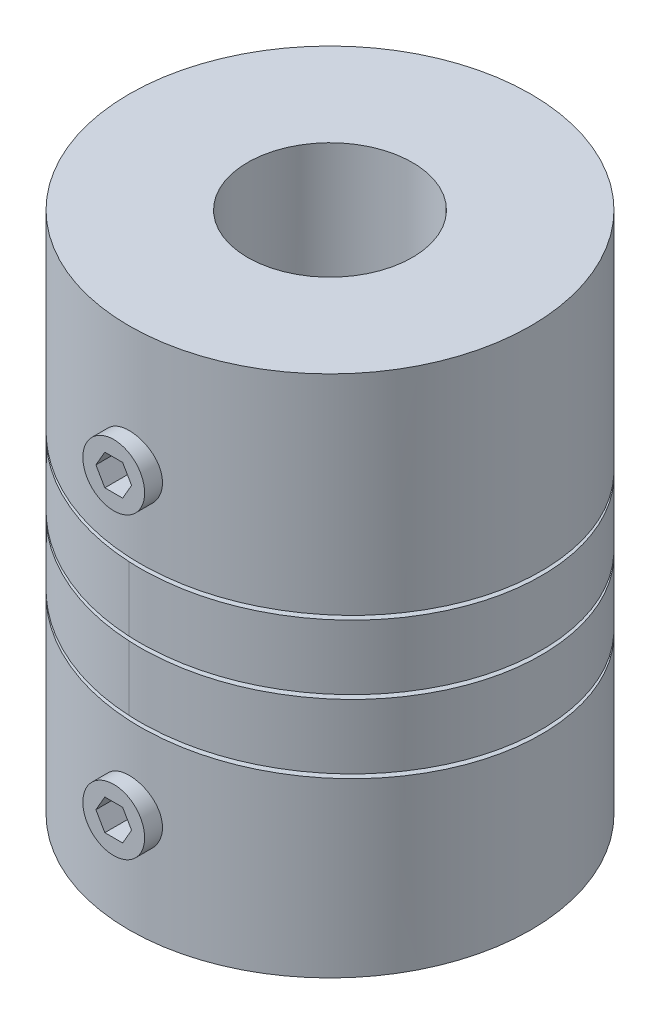
from build123d import *

# Parameters (mm, degrees)
SKETCH1_R             = 9.75
EXTRUDE1_DEPTH        = 25.4
SKETCH2_R             = 4
EXTRUDE2_DEPTH        = 12.7
SKETCH3_R             = 2
EXTRUDE3_DEPTH        = 12.7
SKETCH4_R             = 1.5
EXTRUDE5_DEPTH        = 9.75
CUT_SWEEP8_PITCH      = 3.333333333
EXTRUDE6_DEPTH        = 3
EXTRUDE6_DEPTH_BACK   = 3
SKETCH11_R            = 1.5
EXTRUDE6_2_DEPTH      = 3
EXTRUDE6_2_DEPTH_BACK = 3
EXTRUDE7_DEPTH        = 3


with BuildPart() as part:
    # Sketch1 → Extrude1 (new body)
    with BuildSketch(Plane(origin=(0, 0, 0), x_dir=(1, 0, 0), z_dir=(0, 1, 0))):
        with Locations(Location((0, 0, 0), (0, 0, 270))):
            Circle(SKETCH1_R)
    extrude(amount=EXTRUDE1_DEPTH)

    # Sketch2 → Extrude2 (cut)
    with BuildSketch(Plane(origin=(0, 25.4, 0), x_dir=(-1, 0, 0), z_dir=(0, 1, 0))):
        with Locations(Location((0, 0, 0), (0, 0, 90))):
            Circle(SKETCH2_R)
    extrude(amount=-EXTRUDE2_DEPTH, mode=Mode.SUBTRACT)

    # Sketch3 → Extrude3 (cut)
    with BuildSketch(Plane.XZ):
        with Locations(Location((0, 0, 0), (0, 0, 270))):
            Circle(SKETCH3_R)
    extrude(amount=-EXTRUDE3_DEPTH, mode=Mode.SUBTRACT)

    # Sketch4 → Extrude5 (cut)
    with BuildSketch(Plane.XY.offset(9.75)):
        with Locations(Location((0, 19.5, 0), (0, 0, 270))):
            Circle(SKETCH4_R)
        with Locations((0, 5)):
            Circle(SKETCH4_R)
    extrude(amount=-EXTRUDE5_DEPTH, mode=Mode.SUBTRACT)

    # Cut-Sweep8: the profile of Sketch10 screwed along a left-hand helix of 3 turns, 12 arcs to a turn; built about Z, then put on its axis
    cut_sweep8_z = Axis((0, 0, 0), (0, 0, 1))
    cut_sweep8_corners = [(10, 0, -0.15), (1, 0, -0.15), (1, 0, -0.35), (10, 0, -0.35)]
    with BuildLine(mode=Mode.PRIVATE) as cut_sweep8_profile:
        Line(cut_sweep8_corners[0], cut_sweep8_corners[1])
        Line(cut_sweep8_corners[1], cut_sweep8_corners[2])
        Line(cut_sweep8_corners[2], cut_sweep8_corners[3])
        Line(cut_sweep8_corners[3], cut_sweep8_corners[0])
    cut_sweep8_cap = Face(cut_sweep8_profile.wire())
    cut_sweep8_turn_angles = [0, -15, -30, -45, -60, -75, -90, -105, -120, -135, -150, -165, -180, -195, -210, -225, -240, -255, -270, -285, -300, -315, -330, -345, -360]
    cut_sweep8_turn_weights = [1, 0.9659258262890683, 1, 0.9659258262890683, 1, 0.9659258262890683, 1, 0.9659258262890683, 1, 0.9659258262890683, 1, 0.9659258262890683, 1, 0.9659258262890683, 1, 0.9659258262890683, 1, 0.9659258262890683, 1, 0.9659258262890683, 1, 0.9659258262890683, 1, 0.9659258262890683, 1]
    cut_sweep8_turn_rails = [Edge.make_bspline([Vector(p[0], p[1], 0).rotate(cut_sweep8_z, cut_sweep8_turn_angles[k]) / cut_sweep8_turn_weights[k] + Vector(0, 0, p[2] + -CUT_SWEEP8_PITCH * cut_sweep8_turn_angles[k] / 360) for k in range(25)], [0, 0, 0, 1, 1, 2, 2, 3, 3, 4, 4, 5, 5, 6, 6, 7, 7, 8, 8, 9, 9, 10, 10, 11, 11, 12, 12, 12], 2, cut_sweep8_turn_weights) for p in cut_sweep8_corners]
    cut_sweep8_turn_sides = [Face.make_surface_from_curves(cut_sweep8_turn_rails[p[0]], cut_sweep8_turn_rails[p[1]]) for p in [(0, 1), (1, 2), (2, 3), (3, 0)]]
    cut_sweep8 = Plane(origin=(0, 7.5, 0), x_dir=(0, 0, -1), z_dir=(0, 1, 0)) * Solid(Shell([*[p.moved(Location((0, 0, CUT_SWEEP8_PITCH * i))) for i in range(3) for p in cut_sweep8_turn_sides], cut_sweep8_cap, cut_sweep8_cap.rotate(cut_sweep8_z, -1080).moved(Location((0, 0, -CUT_SWEEP8_PITCH * -1080 / 360)))]))
    add(cut_sweep8, mode=Mode.SUBTRACT)


with BuildPart() as body_2:
    # Sketch11 → Extrude6 (new, two sides: drawn at the far end of the back side and taken through both)
    with BuildSketch(Plane.XY.offset(7.5).offset(-EXTRUDE6_DEPTH_BACK)):
        with Locations((0, 19.5)):
            Circle(SKETCH11_R)
    extrude(amount=EXTRUDE6_DEPTH + EXTRUDE6_DEPTH_BACK)


with BuildPart() as body_3:
    # Sketch11 → Extrude6 2 (new, two sides: drawn at the far end of the back side and taken through both)
    with BuildSketch(Plane.XY.offset(7.5).offset(-EXTRUDE6_2_DEPTH_BACK)):
        with Locations((0, 5)):
            Circle(SKETCH11_R)
    extrude(amount=EXTRUDE6_2_DEPTH + EXTRUDE6_2_DEPTH_BACK)


with BuildPart() as extrude7_tool:
    # Sketch12 → Extrude7 (new body)
    with BuildSketch(Plane.XY.offset(10.5)):
        Polygon((0.866025404, 5), (0.433012702, 5.75), (-0.433012702, 5.75), (-0.866025404, 5), (-0.433012702, 4.25), (0.433012702, 4.25), align=None)
        Polygon((0.866025404, 19.5), (0.433012702, 20.25), (-0.433012702, 20.25), (-0.866025404, 19.5), (-0.433012702, 18.75), (0.433012702, 18.75), align=None)
    extrude(amount=-EXTRUDE7_DEPTH)


with BuildPart() as body_2_1:
    add(body_2.part)

    # Extrude7: cut by extrude7_tool
    add(extrude7_tool.part, mode=Mode.SUBTRACT)


with BuildPart() as body_3_1:
    add(body_3.part)

    # Extrude7: cut by extrude7_tool
    add(extrude7_tool.part, mode=Mode.SUBTRACT)


solid = Compound([part.part, body_2_1.part, body_3_1.part])
